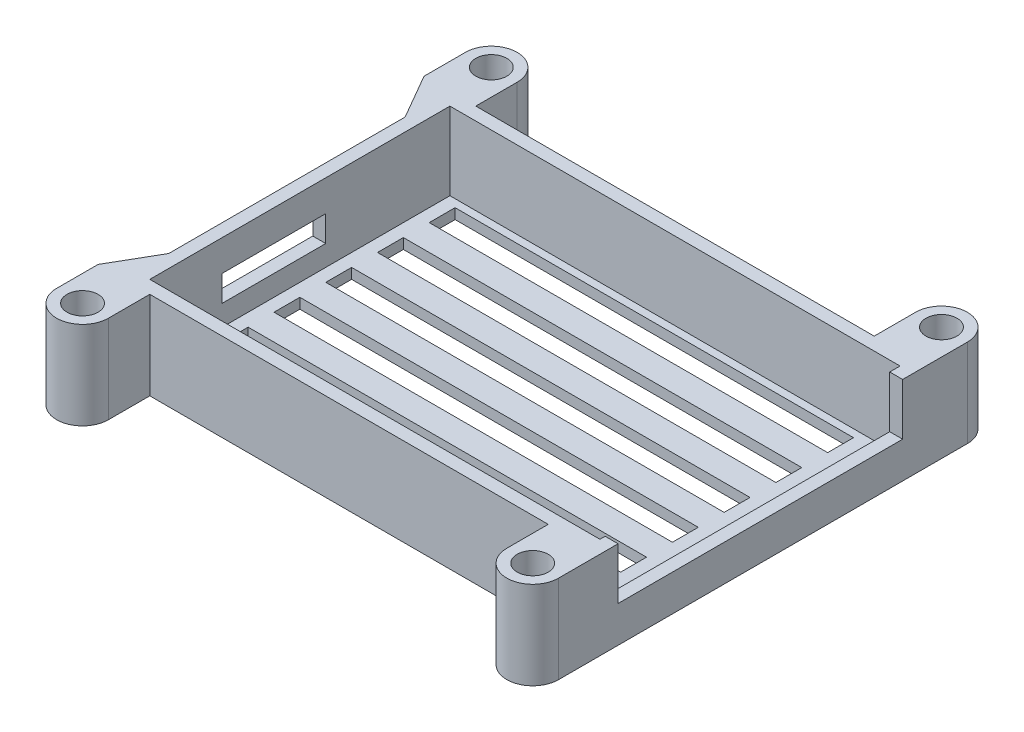
from build123d import *

# Parameters (mm, degrees)
BOSS_EXTRUDE1_DEPTH = 2
SKETCH6_W           = 87
SKETCH6_H           = 58.002207555
BOSS_EXTRUDE3_DEPTH = 15
SKETCH10_W          = 2.5
SKETCH10_H          = 55.002207555
CUT_EXTRUDE2_DEPTH  = 10
HOLE5_START         = -1
HOLE5_OUTLINE_R     = 3
HOLE5_DEPTH         = 18
SKETCH15_W          = 20
SKETCH15_H          = 5
CUT_EXTRUDE4_DEPTH  = 2.5
SKETCH_2_W          = 77
SKETCH_2_H          = 5
SKETCH_2_H_2        = 5.00441511
CUT_EXTRUDE_4_DEPTH = 10


with BuildPart() as part:
    # Sketch1 → Boss-Extrude1 (new body)
    with BuildSketch(Plane(origin=(0, 0, 0), x_dir=(1, 0, 0), z_dir=(0, 1, 0))):
        with BuildLine():
            Line((-46, 22.841953517), (-46, -22.841953517))
            Line((-46, -22.841953517), (-51, -31.502207555))
            Line((-51, -31.502207555), (-51, -39.502207555))
            ThreePointArc((-51, -39.502207555), (-46, -44.502207555), (-41, -39.502207555))
            Line((-41, -39.502207555), (-41, -31.502207555))
            Line((-41, -31.502207555), (36, -31.502207555))
            Line((36, -31.502207555), (36, -39.502207555))
            ThreePointArc((36, -39.502207555), (41, -44.502207555), (46, -39.502207555))
            Line((46, -39.502207555), (46, 39.502207555))
            ThreePointArc((46, 39.502207555), (41, 44.502207555), (36, 39.502207555))
            Line((36, 39.502207555), (36, 31.502207555))
            Line((36, 31.502207555), (-41, 31.502207555))
            Line((-41, 31.502207555), (-41, 39.502207555))
            ThreePointArc((-41, 39.502207555), (-46, 44.502207555), (-51, 39.502207555))
            Line((-51, 39.502207555), (-51, 31.502207555))
            Line((-51, 31.502207555), (-46, 22.841953517))
        make_face()
    extrude(amount=BOSS_EXTRUDE1_DEPTH)

    # Sketch6 → Boss-Extrude3 (add)
    with BuildSketch(Plane(origin=(0, 2, 0), x_dir=(1, 0, 0), z_dir=(0, 1, 0))):
        with BuildLine():
            Line((-46, -22.841953517), (-51, -31.502207555))
            Line((-51, -31.502207555), (-51, -39.502207555))
            ThreePointArc((-51, -39.502207555), (-46, -44.502207555), (-41, -39.502207555))
            Line((-41, -39.502207555), (-41, -31.502207555))
            Line((-41, -31.502207555), (36, -31.502207555))
            Line((36, -31.502207555), (36, -39.502207555))
            ThreePointArc((36, -39.502207555), (41, -44.502207555), (46, -39.502207555))
            Line((46, -39.502207555), (46, 39.502207555))
            ThreePointArc((46, 39.502207555), (41, 44.502207555), (36, 39.502207555))
            Line((36, 39.502207555), (36, 31.502207555))
            Line((36, 31.502207555), (-41, 31.502207555))
            Line((-41, 31.502207555), (-41, 39.502207555))
            ThreePointArc((-41, 39.502207555), (-46, 44.502207555), (-51, 39.502207555))
            Line((-51, 39.502207555), (-51, 31.502207555))
            Line((-51, 31.502207555), (-46, 22.841953517))
            Line((-46, 22.841953517), (-46, -22.841953517))
        make_face()
        with Locations((0, -0.001103777)):
            Rectangle(SKETCH6_W, SKETCH6_H, mode=Mode.SUBTRACT)
    extrude(amount=BOSS_EXTRUDE3_DEPTH)

    # Sketch10 → Cut-Extrude2 (cut)
    with BuildSketch(Plane(origin=(0, 17, 0), x_dir=(1, 0, 0), z_dir=(0, 1, 0))):
        with Locations((44.75, -0.501103778)):
            Rectangle(SKETCH10_W, SKETCH10_H)
    extrude(amount=-CUT_EXTRUDE2_DEPTH, mode=Mode.SUBTRACT)

    # Hole5: read off the stored shape, not the designer's step
    # Hole5 outline → Hole5 (cut)
    with BuildSketch(Plane(origin=(0, 0, 0), x_dir=(1, 0, 0), z_dir=(0, 1, 0)).offset(HOLE5_START)):
        with Locations((-46, -39.502207555)):
            Circle(HOLE5_OUTLINE_R)
        with Locations((41, -39.502207555)):
            Circle(HOLE5_OUTLINE_R)
        with Locations((41, 39.502207555)):
            Circle(HOLE5_OUTLINE_R)
        with Locations((-46, 39.502207555)):
            Circle(HOLE5_OUTLINE_R)
    extrude(amount=HOLE5_DEPTH, mode=Mode.SUBTRACT)

    # Sketch15 → Cut-Extrude4 (cut)
    with BuildSketch(Plane.ZY.offset(46)):
        with Locations((5, 8.5)):
            Rectangle(SKETCH15_W, SKETCH15_H)
    extrude(amount=-CUT_EXTRUDE4_DEPTH, mode=Mode.SUBTRACT)

    # 草图2 → 切除-拉伸4 (cut)
    with BuildSketch(Plane.XZ):
        with Locations((-2.5, -25.002207555)):
            Rectangle(SKETCH_2_W, SKETCH_2_H)
        with Locations((-2.5, -15.002207555)):
            Rectangle(SKETCH_2_W, SKETCH_2_H)
        with Locations((-2.5, -5.002207555)):
            Rectangle(SKETCH_2_W, SKETCH_2_H)
        with Locations((-2.5, 4.997792445)):
            Rectangle(SKETCH_2_W, SKETCH_2_H)
        with Locations((-2.5, 14.997792445)):
            Rectangle(SKETCH_2_W, SKETCH_2_H)
        with Locations((-2.5, 25)):
            Rectangle(SKETCH_2_W, SKETCH_2_H_2)
    extrude(amount=-CUT_EXTRUDE_4_DEPTH, mode=Mode.SUBTRACT)


solid = part.part
